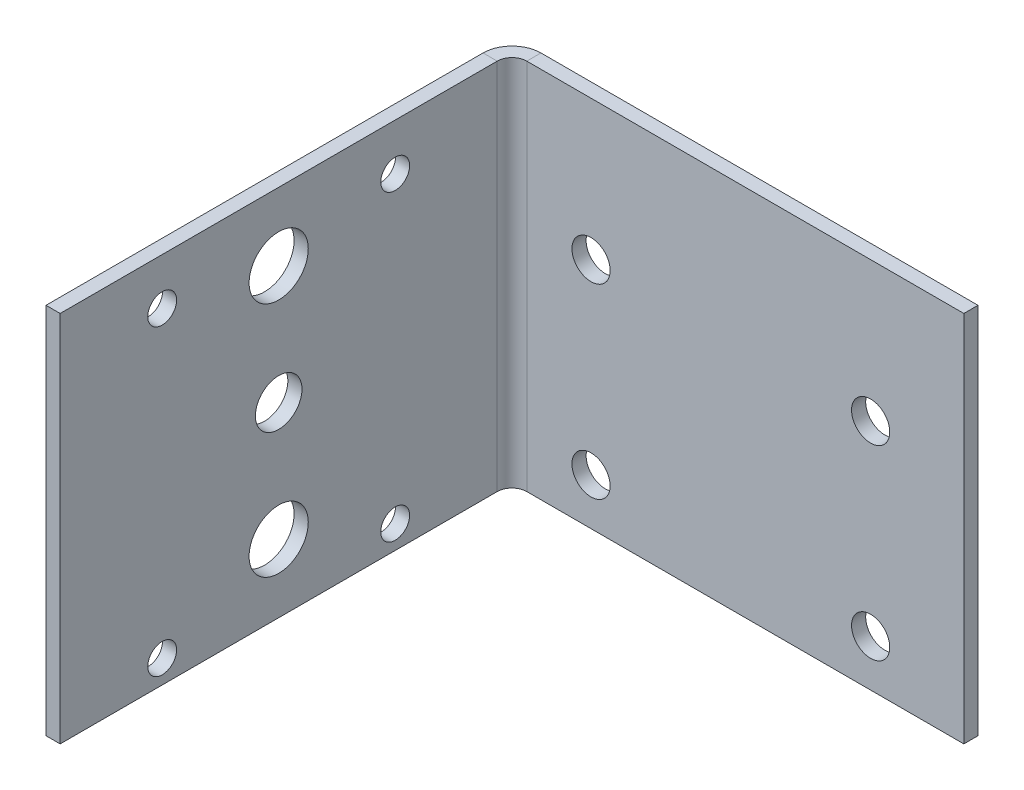
from build123d import *

# Parameters (mm, degrees)
CROQUIS1_W                       = 100
CROQUIS1_H                       = 80
CROQUIS1_R                       = 4.1
BRIDA_BASE1_DEPTH                = 3.03784
BRIDA_DE_ARISTA1_STRIP_W         = 18.50136
BRIDA_DE_ARISTA1_STRIP_H         = 3.03784
BRIDA_DE_ARISTA1_STRIP_CUT_DEPTH = 80
BRIDA_DE_ARISTA1_DEPTH           = 80
CORTAR_EXTRUIR1_REACH            = 146.919
CROQUIS9_R                       = 6.35
CROQUIS9_R_2                     = 3.1
CROQUIS9_R_3                     = 5


# Sheet-metal steps are written as plain solids
with BuildPart() as part:
    # Croquis1 → Brida base1 (new body)
    with BuildSketch(Plane.XY):
        Rectangle(CROQUIS1_W, CROQUIS1_H)
        with Locations((-30, 10)):
            Circle(CROQUIS1_R, mode=Mode.SUBTRACT)
        with Locations((30, 10)):
            Circle(CROQUIS1_R, mode=Mode.SUBTRACT)
        with Locations((-30, -30)):
            Circle(CROQUIS1_R, mode=Mode.SUBTRACT)
        with Locations((30, -30)):
            Circle(CROQUIS1_R, mode=Mode.SUBTRACT)
    extrude(amount=-BRIDA_BASE1_DEPTH)

    # Brida de arista1 strip (across the edge) → Brida de arista1 strip cut (cut)
    with BuildSketch(Plane(origin=(-50, 40, 0), x_dir=(1, 0, 0), z_dir=(0, -1, 0))):
        with Locations((-3.03784, -1.51892)):
            Rectangle(BRIDA_DE_ARISTA1_STRIP_W, BRIDA_DE_ARISTA1_STRIP_H)
    extrude(amount=BRIDA_DE_ARISTA1_STRIP_CUT_DEPTH, mode=Mode.SUBTRACT)

    # Brida de arista1 section (across the edge) → Brida de arista1 (add)
    with BuildSketch(Plane(origin=(-50, 40, 0), x_dir=(1, 0, 0), z_dir=(0, -1, 0))):
        with BuildLine():
            Line((0, 3.175), (0, 96.96216))
            Line((0, 96.96216), (3.03784, 96.96216))
            Line((3.03784, 96.96216), (3.03784, 3.175))
            ThreePointArc((3.03784, 3.175), (3.96777597, 0.92993597), (6.21284, 0))
            Line((6.21284, 0), (6.21284, -3.03784))
            ThreePointArc((6.21284, -3.03784), (1.819698706, -1.218141294), (0, 3.175))
        make_face()
    extrude(amount=BRIDA_DE_ARISTA1_DEPTH)

    # Croquis9 → Cortar-Extruir1 (cut, up to next)
    with BuildSketch(Plane.ZY.offset(50), mode=Mode.PRIVATE) as cortar_extruir1_sk1:
        with Locations((50.06858, 25.4)):
            Circle(CROQUIS9_R)
    cortar_extruir1_tool1 = extrude(cortar_extruir1_sk1.sketch, amount=-CORTAR_EXTRUIR1_REACH, mode=Mode.PRIVATE) & part.part
    # Croquis9 → Cortar-Extruir1 (cut, up to next)
    with BuildSketch(Plane.ZY.offset(50), mode=Mode.PRIVATE) as cortar_extruir1_sk2:
        with Locations((50.06858, -25.4)):
            Circle(CROQUIS9_R)
    cortar_extruir1_tool2 = extrude(cortar_extruir1_sk2.sketch, amount=-CORTAR_EXTRUIR1_REACH, mode=Mode.PRIVATE) & part.part
    # Croquis9 → Cortar-Extruir1 (cut, up to next)
    with BuildSketch(Plane.ZY.offset(50), mode=Mode.PRIVATE) as cortar_extruir1_sk3:
        with Locations((25.06858, 30)):
            Circle(CROQUIS9_R_2)
    cortar_extruir1_tool3 = extrude(cortar_extruir1_sk3.sketch, amount=-CORTAR_EXTRUIR1_REACH, mode=Mode.PRIVATE) & part.part
    # Croquis9 → Cortar-Extruir1 (cut, up to next)
    with BuildSketch(Plane.ZY.offset(50), mode=Mode.PRIVATE) as cortar_extruir1_sk4:
        with Locations((75.06858, 30)):
            Circle(CROQUIS9_R_2)
    cortar_extruir1_tool4 = extrude(cortar_extruir1_sk4.sketch, amount=-CORTAR_EXTRUIR1_REACH, mode=Mode.PRIVATE) & part.part
    # Croquis9 → Cortar-Extruir1 (cut, up to next)
    with BuildSketch(Plane.ZY.offset(50), mode=Mode.PRIVATE) as cortar_extruir1_sk5:
        with Locations((25.06858, -35)):
            Circle(CROQUIS9_R_2)
    cortar_extruir1_tool5 = extrude(cortar_extruir1_sk5.sketch, amount=-CORTAR_EXTRUIR1_REACH, mode=Mode.PRIVATE) & part.part
    # Croquis9 → Cortar-Extruir1 (cut, up to next)
    with BuildSketch(Plane.ZY.offset(50), mode=Mode.PRIVATE) as cortar_extruir1_sk6:
        with Locations((75.06858, -35)):
            Circle(CROQUIS9_R_2)
    cortar_extruir1_tool6 = extrude(cortar_extruir1_sk6.sketch, amount=-CORTAR_EXTRUIR1_REACH, mode=Mode.PRIVATE) & part.part
    # Croquis9 → Cortar-Extruir1 (cut, up to next)
    with BuildSketch(Plane.ZY.offset(50), mode=Mode.PRIVATE) as cortar_extruir1_sk7:
        with Locations((50.06858, 0)):
            Circle(CROQUIS9_R_3)
    cortar_extruir1_tool7 = extrude(cortar_extruir1_sk7.sketch, amount=-CORTAR_EXTRUIR1_REACH, mode=Mode.PRIVATE) & part.part
    add(cortar_extruir1_tool1.solids().sort_by_distance((-50, 25.4, 50.06858))[0], mode=Mode.SUBTRACT)
    add(cortar_extruir1_tool2.solids().sort_by_distance((-50, -25.4, 50.06858))[0], mode=Mode.SUBTRACT)
    add(cortar_extruir1_tool3.solids().sort_by_distance((-50, 30, 25.06858))[0], mode=Mode.SUBTRACT)
    add(cortar_extruir1_tool4.solids().sort_by_distance((-50, 30, 75.06858))[0], mode=Mode.SUBTRACT)
    add(cortar_extruir1_tool5.solids().sort_by_distance((-50, -35, 25.06858))[0], mode=Mode.SUBTRACT)
    add(cortar_extruir1_tool6.solids().sort_by_distance((-50, -35, 75.06858))[0], mode=Mode.SUBTRACT)
    add(cortar_extruir1_tool7.solids().sort_by_distance((-50, 0, 50.06858))[0], mode=Mode.SUBTRACT)


solid = part.part
